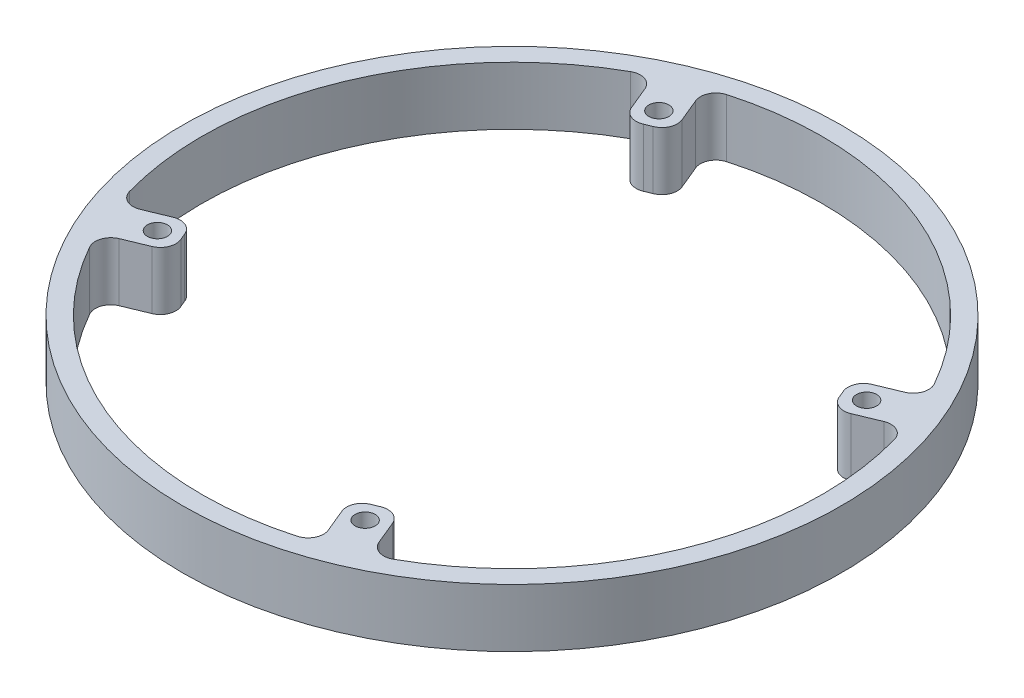
from build123d import *

# Parameters (mm, degrees)
SKETCH2_W                  = 19.99983
SKETCH2_H                  = 15
F_6_0_204_DIAMETER_HOLE1_D = 5.1816
CIRPATTERN3_COUNT          = 4
CUT_EXTRUDE1_DEPTH         = 122.14017583
FILLET1_R                  = 4
CIRPATTERN4_COUNT          = 4
FILLET1_OF_CIRPATTERN4_R   = 4


with BuildPart() as part:
    # Sketch2 → Revolve1 (revolve)
    with BuildSketch(Plane(origin=(0, 0, 0), x_dir=(0, 0, -1), z_dir=(1, 0, 0))):
        with Locations((-74.999915, 7.5)):
            Rectangle(SKETCH2_W, SKETCH2_H)
    revolve(axis=Axis((0, -0.75, 0), (0, 1, 0)))

    # #6 (0.204) Diameter Hole1 (through all)
    with Locations(Plane(origin=(0, 15, 0), x_dir=(1, 0, 0), z_dir=(0, 1, 0))):
        with Locations((-26.787840266, 64.671567276)):
            f_6_0_204_diameter_hole1 = Hole(F_6_0_204_DIAMETER_HOLE1_D / 2)

    # CirPattern3: #6 (0.204) Diameter Hole1 ×4 about axis
    cirpattern3_axis = Axis((0, -0.75, 0), (0, 1, 0))
    for i in range(1, CIRPATTERN3_COUNT):
        add(f_6_0_204_diameter_hole1.rotate(cirpattern3_axis, i * 360 / CIRPATTERN3_COUNT), mode=Mode.SUBTRACT)

    # Sketch8 → Cut-Extrude1 (cut, through all)
    with BuildSketch(Plane(origin=(0, 15, 0), x_dir=(1, 0, 0), z_dir=(0, 1, 0))):
        with BuildLine():
            Line((-4.754393761, 24.543751546), (-25.93535895, 75.67912497))
            ThreePointArc((-25.93535895, 75.67912497), (30.614609533, 73.910205541), (71.852290646, 35.174154275))
            Line((71.852290646, 35.174154275), (20.716917223, 13.993189086))
            ThreePointArc((20.716917223, 13.993189086), (9.567085809, 23.096988313), (-4.754393761, 24.543751546))
        make_face()
    cut_extrude1 = extrude(amount=-CUT_EXTRUDE1_DEPTH, mode=Mode.SUBTRACT)

    # Fillet1
    fillet1_edges = [part.edges().sort_by_distance(p)[0] for p in [
        (71.852290646, 7.5, -35.174154275),
        (-25.93535895, 7.5, -75.67912497),
        (57.960819706, 7.5, -29.42011861),
        (-20.181323285, 7.5, -61.78765403),
    ]]
    fillet(fillet1_edges, radius=FILLET1_R)

    # CirPattern4: Cut-Extrude1 ×4 about axis
    cirpattern4_axis = Axis((0, -0.75, 0), (0, 1, 0))
    for i in range(1, CIRPATTERN4_COUNT):
        add(cut_extrude1.rotate(cirpattern4_axis, i * 360 / CIRPATTERN4_COUNT), mode=Mode.SUBTRACT)

    # Fillet1 of CirPattern4
    fillet1_of_cirpattern4_edges = [part.edges().sort_by_distance(p)[0] for p in [
        (-35.174154275, 7.5, -71.852290646),
        (-75.67912497, 7.5, 25.93535895),
        (-29.42011861, 7.5, -57.960819706),
        (-61.78765403, 7.5, 20.181323285),
        (-71.852290646, 7.5, 35.174154275),
        (25.93535895, 7.5, 75.67912497),
        (-57.960819706, 7.5, 29.42011861),
        (20.181323285, 7.5, 61.78765403),
        (35.174154275, 7.5, 71.852290646),
        (75.67912497, 7.5, -25.93535895),
        (29.42011861, 7.5, 57.960819706),
        (61.78765403, 7.5, -20.181323285),
    ]]
    fillet(fillet1_of_cirpattern4_edges, radius=FILLET1_OF_CIRPATTERN4_R)


solid = part.part
